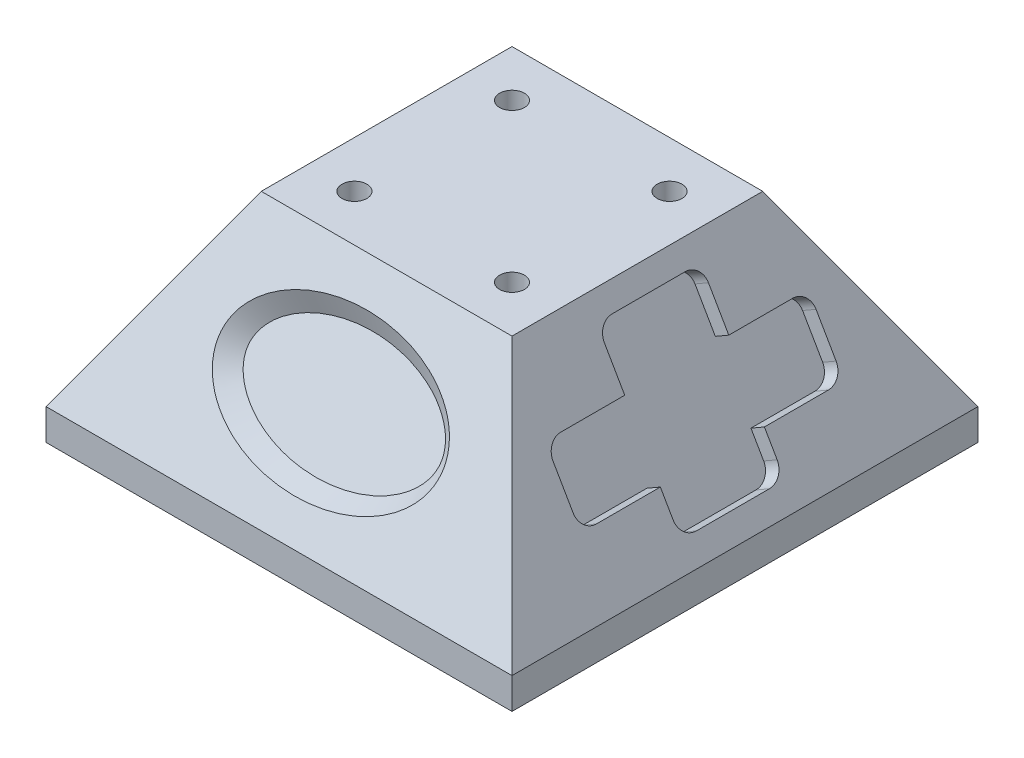
from build123d import *

# Parameters (mm, degrees)
SKETCH1_W                    = 150
SKETCH1_H                    = 150
EXTRUDE1_DEPTH               = 10
EXTRUDE1_OTHER_WAY_DEPTH     = 60
EXTRUDE1_OTHER_WAY_TAPER     = 30
SKETCH6_RX                   = 36.340108176
SKETCH6_RY                   = 23.255344982
CUT_EXTRUDE1_DEPTH           = 5
CUT_EXTRUDE1_TAPER           = 45
CUT_EXTRUDE2_DEPTH           = 5
F_8_0_8_DIAMETER_HOLE1_D     = 8
F_8_0_8_DIAMETER_HOLE1_DEPTH = 15
F_8_0_8_DIAMETER_HOLE1_TIP   = 2.403442476


with BuildPart() as part:
    # Sketch1 → Extrude1 (new body)
    with BuildSketch(Plane(origin=(0, 0, 0), x_dir=(1, 0, 0), z_dir=(0, 1, 0))):
        Rectangle(SKETCH1_W, SKETCH1_H)
    extrude(amount=-EXTRUDE1_DEPTH)

    # Sketch1 → Extrude1 other way (add)
    with BuildSketch(Plane(origin=(0, 0, 0), x_dir=(1, 0, 0), z_dir=(0, 1, 0))):
        Rectangle(SKETCH1_W, SKETCH1_H)
    extrude(amount=EXTRUDE1_OTHER_WAY_DEPTH, taper=EXTRUDE1_OTHER_WAY_TAPER)


with BuildPart() as part_1:
    # Body-Move/Copy1: read off the stored shape, not the designer's step
    # Body-Move/Copy1: moved
    add(part.part.moved(Location((0, -60, 0))))

    # Sketch6 → Cut-Extrude1 (cut)
    with BuildSketch(Plane(origin=(0, 17.475952642, 30.269237886), x_dir=(1, 0, 0), z_dir=(0, 0.500000000000001, 0.8660254037844382))):
        with Locations((-0.435268908, -55.193628745)):
            Ellipse(SKETCH6_RX, SKETCH6_RY)
    extrude(amount=-CUT_EXTRUDE1_DEPTH, taper=CUT_EXTRUDE1_TAPER, mode=Mode.SUBTRACT)

    # Sketch7 → Cut-Extrude2 (cut)
    with BuildSketch(Plane(origin=(30.269237886, 17.475952642, 0), x_dir=(0, 0, -1), z_dir=(0.8660254037844382, 0.500000000000001, 0))):
        with BuildLine():
            Line((16.748986982, -68.458804055), (16.748986982, -76.659273992))
            ThreePointArc((16.748986982, -76.659273992), (15.284520888, -80.194807898), (11.748986982, -81.659273992))
            Line((11.748986982, -81.659273992), (-11.748986982, -81.659273992))
            ThreePointArc((-11.748986982, -81.659273992), (-15.284520888, -80.194807898), (-16.748986982, -76.659273992))
            Line((-16.748986982, -76.659273992), (-16.748986982, -68.458804055))
            Line((-16.748986982, -68.458804055), (-37.328256119, -68.458804055))
            ThreePointArc((-37.328256119, -68.458804055), (-40.863790024, -66.994337961), (-42.328256119, -63.458804055))
            Line((-42.328256119, -63.458804055), (-42.328256119, -50.531459403))
            ThreePointArc((-42.328256119, -50.531459403), (-40.863790024, -46.995925497), (-37.328256119, -45.531459403))
            Line((-37.328256119, -45.531459403), (-16.748986982, -45.531459403))
            Line((-16.748986982, -45.531459403), (-16.748986982, -32.438583938))
            ThreePointArc((-16.748986982, -32.438583938), (-15.284520888, -28.903050032), (-11.748986982, -27.438583938))
            Line((-11.748986982, -27.438583938), (11.748986982, -27.438583938))
            ThreePointArc((11.748986982, -27.438583938), (15.284520888, -28.903050032), (16.748986982, -32.438583938))
            Line((16.748986982, -32.438583938), (16.748986982, -45.531459403))
            Line((16.748986982, -45.531459403), (37.328256119, -45.531459403))
            ThreePointArc((37.328256119, -45.531459403), (40.863790024, -46.995925497), (42.328256119, -50.531459403))
            Line((42.328256119, -50.531459403), (42.328256119, -63.458804055))
            ThreePointArc((42.328256119, -63.458804055), (40.863790024, -66.994337961), (37.328256119, -68.458804055))
            Line((37.328256119, -68.458804055), (16.748986982, -68.458804055))
        make_face()
    extrude(amount=-CUT_EXTRUDE2_DEPTH, mode=Mode.SUBTRACT)

    # Ø8.0 (8) Diameter Hole1
    with Locations(Plane(origin=(-25.358983849, 0, 25.358983849), x_dir=(0, 0, 1), z_dir=(0, 1, 0))):
        with Locations((0, 0), (0, 50.717967698), (-50.717967698, 50.717967698), (-50.717967698, 0)):
            Hole(F_8_0_8_DIAMETER_HOLE1_D / 2, depth=F_8_0_8_DIAMETER_HOLE1_DEPTH)
            with Locations((0, 0, -(F_8_0_8_DIAMETER_HOLE1_DEPTH + F_8_0_8_DIAMETER_HOLE1_TIP / 2))):  # 118° drill point
                Cone(0, F_8_0_8_DIAMETER_HOLE1_D / 2, F_8_0_8_DIAMETER_HOLE1_TIP, mode=Mode.SUBTRACT)


solid = part_1.part
